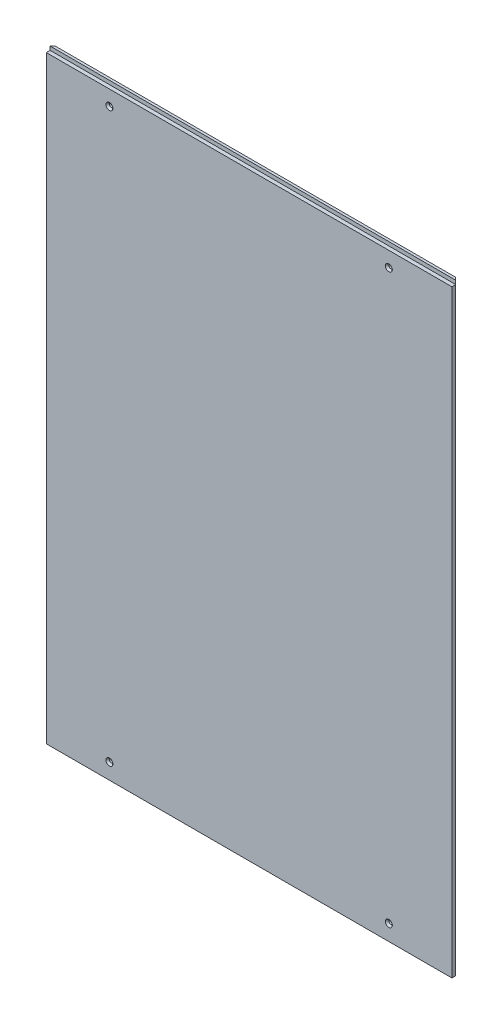
from build123d import *

# Parameters (mm, degrees)
SKETCH1_W           = 643
SKETCH1_H           = 955
BOSS_EXTRUDE1_DEPTH = 10
SKETCH2_W           = 6
SKETCH2_H           = 6
CUT_EXTRUDE1_DEPTH  = 801.971441438
CHAMFER1_SIZE       = 4
SKETCH3_R           = 2.6
CUT_EXTRUDE2_DEPTH  = 576.733011039
CHAMFER2_SIZE       = 2.9
SKETCH4_R           = 6
CUT_EXTRUDE3_DEPTH  = 4


with BuildPart() as part:
    # Sketch1 → Boss-Extrude1 (new body)
    with BuildSketch(Plane.XY):
        Rectangle(SKETCH1_W, SKETCH1_H)
    extrude(amount=BOSS_EXTRUDE1_DEPTH)

    # Sketch2 → Cut-Extrude1 (cut, through all)
    with BuildSketch(Plane.ZY.offset(321.5)):
        with Locations((7, 474.5)):
            Rectangle(SKETCH2_W, SKETCH2_H)
    extrude(amount=-CUT_EXTRUDE1_DEPTH, mode=Mode.SUBTRACT)

    # Chamfer1
    chamfer1_edges = [part.edges().sort_by_distance(p)[0] for p in [
        (321.5, 0, 0),
        (-321.5, 0, 0),
    ]]
    chamfer(chamfer1_edges, length=CHAMFER1_SIZE - 0.0001)  # a hair under: the kernel refuses the full size

    # Sketch3 → Cut-Extrude2 (cut, through all)
    with BuildSketch(Plane(origin=(0, 0, 0), x_dir=(-1, 0, 0), z_dir=(0, 0, -1))):
        with Locations((-221.5, -452.5)):
            Circle(SKETCH3_R)
        with Locations((221.5, -452.5)):
            Circle(SKETCH3_R)
        with Locations((221.5, 447.5)):
            Circle(SKETCH3_R)
        with Locations((-221.5, 447.5)):
            Circle(SKETCH3_R)
    extrude(amount=-CUT_EXTRUDE2_DEPTH, mode=Mode.SUBTRACT)

    # Chamfer2
    chamfer2_edges = [part.edges().sort_by_distance(p)[0] for p in [
        (224.1, -452.5, 10),
        (-218.9, -452.5, 10),
        (-218.9, 447.5, 10),
        (224.1, 447.5, 10),
    ]]
    chamfer(chamfer2_edges, length=CHAMFER2_SIZE)

    # Sketch4 → Cut-Extrude3 (cut)
    with BuildSketch(Plane(origin=(0, 0, 0), x_dir=(-1, 0, 0), z_dir=(0, 0, -1))):
        with Locations((-241.5, 447.5)):
            Circle(SKETCH4_R)
        with Locations((-201.5, 447.5)):
            Circle(SKETCH4_R)
        with Locations((201.5, 447.5)):
            Circle(SKETCH4_R)
        with Locations((241.5, 447.5)):
            Circle(SKETCH4_R)
    extrude(amount=-CUT_EXTRUDE3_DEPTH, mode=Mode.SUBTRACT)


solid = part.part
